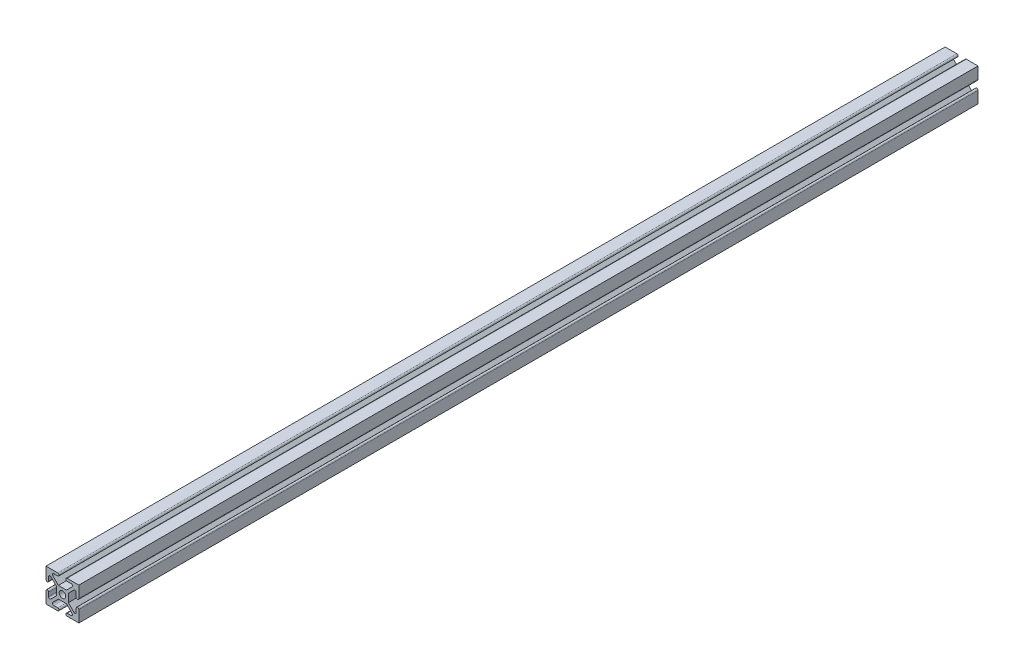
from build123d import *

# Parameters (mm, degrees)
SKETCH2_R               = 2.5
BOSS_EXTRUDE1_DEPTH     = 200
CROQUIS1_R              = 2.5
SALIENTE_EXTRUIR1_DEPTH = 484


with BuildPart() as part:
    # Sketch2 → Boss-Extrude1 (new body)
    with BuildSketch(Plane.XY):
        with BuildLine():
            Line((12.5, 17), (9.414213562, 17))
            Line((9.414213562, 17), (5.171572875, 21.242640687))
            ThreePointArc((5.171572875, 21.242640687), (4.94841893, 22.364511329), (5.899494937, 23))
            Line((5.899494937, 23), (8.899494937, 23))
            ThreePointArc((8.899494937, 23), (9.899494937, 24), (8.899494937, 25))
            Line((8.899494937, 25), (0, 25))
            Line((0, 25), (0, 16.100505063))
            ThreePointArc((0, 16.100505063), (1, 15.100505063), (2, 16.100505063))
            Line((2, 16.100505063), (2, 19.100505063))
            ThreePointArc((2, 19.100505063), (2.635488671, 20.05158107), (3.757359313, 19.828427125))
            Line((3.757359313, 19.828427125), (8, 15.585786438))
            Line((8, 15.585786438), (8, 12.5))
            Line((8, 12.5), (8, 9.414213562))
            Line((8, 9.414213562), (3.757359313, 5.171572875))
            ThreePointArc((3.757359313, 5.171572875), (2.635488671, 4.94841893), (2, 5.899494937))
            Line((2, 5.899494937), (2, 8.899494937))
            ThreePointArc((2, 8.899494937), (1, 9.899494937), (0, 8.899494937))
            Line((0, 8.899494937), (0, 0))
            Line((0, 0), (8.899494937, 0))
            ThreePointArc((8.899494937, 0), (9.899494937, 1), (8.899494937, 2))
            Line((8.899494937, 2), (5.899494937, 2))
            ThreePointArc((5.899494937, 2), (4.94841893, 2.635488671), (5.171572875, 3.757359313))
            Line((5.171572875, 3.757359313), (9.414213562, 8))
            Line((9.414213562, 8), (12.5, 8))
            Line((12.5, 8), (15.585786438, 8))
            Line((15.585786438, 8), (19.828427125, 3.757359313))
            ThreePointArc((19.828427125, 3.757359313), (20.05158107, 2.635488671), (19.100505063, 2))
            Line((19.100505063, 2), (16.100505063, 2))
            ThreePointArc((16.100505063, 2), (15.100505063, 1), (16.100505063, 0))
            Line((16.100505063, 0), (25, 0))
            Line((25, 0), (25, 8.899494937))
            ThreePointArc((25, 8.899494937), (24, 9.899494937), (23, 8.899494937))
            Line((23, 8.899494937), (23, 5.899494937))
            ThreePointArc((23, 5.899494937), (22.364511329, 4.94841893), (21.242640687, 5.171572875))
            Line((21.242640687, 5.171572875), (17, 9.414213562))
            Line((17, 9.414213562), (17, 12.5))
            Line((17, 12.5), (17, 15.585786438))
            Line((17, 15.585786438), (21.242640687, 19.828427125))
            ThreePointArc((21.242640687, 19.828427125), (22.364511329, 20.05158107), (23, 19.100505063))
            Line((23, 19.100505063), (23, 16.100505063))
            ThreePointArc((23, 16.100505063), (24, 15.100505063), (25, 16.100505063))
            Line((25, 16.100505063), (25, 25))
            Line((25, 25), (16.100505063, 25))
            ThreePointArc((16.100505063, 25), (15.100505063, 24), (16.100505063, 23))
            Line((16.100505063, 23), (19.100505063, 23))
            ThreePointArc((19.100505063, 23), (20.05158107, 22.364511329), (19.828427125, 21.242640687))
            Line((19.828427125, 21.242640687), (15.585786438, 17))
            Line((15.585786438, 17), (12.5, 17))
        make_face()
        with Locations((12.5, 12.5)):
            Circle(SKETCH2_R, mode=Mode.SUBTRACT)
    extrude(amount=BOSS_EXTRUDE1_DEPTH)

    # Croquis1 → Saliente-Extruir1 (add)
    with BuildSketch(Plane.XY.offset(200)):
        with BuildLine():
            ThreePointArc((2, 8.899494937), (1, 9.899494937), (0, 8.899494937))
            Line((0, 8.899494937), (0, 0))
            Line((0, 0), (8.899494937, 0))
            ThreePointArc((8.899494937, 0), (9.899494937, 1), (8.899494937, 2))
            Line((8.899494937, 2), (5.93353822, 2))
            ThreePointArc((5.93353822, 2), (4.947899018, 2.635273316), (5.195645112, 3.78143155))
            Line((5.195645112, 3.78143155), (9.414213562, 8))
            Line((9.414213562, 8), (15.585786438, 8))
            Line((15.585786438, 8), (19.828427125, 3.757359313))
            ThreePointArc((19.828427125, 3.757359313), (20.05158107, 2.635488671), (19.100505063, 2))
            Line((19.100505063, 2), (16.100505063, 2))
            ThreePointArc((16.100505063, 2), (15.100505063, 1), (16.100505063, 0))
            Line((16.100505063, 0), (25, 0))
            Line((25, 0), (25, 8.899494937))
            ThreePointArc((25, 8.899494937), (24, 9.899494937), (23, 8.899494937))
            Line((23, 8.899494937), (23, 5.899494937))
            ThreePointArc((23, 5.899494937), (22.364511329, 4.94841893), (21.242640687, 5.171572875))
            Line((21.242640687, 5.171572875), (17, 9.414213562))
            Line((17, 9.414213562), (17, 15.585786438))
            Line((17, 15.585786438), (21.242640687, 19.828427125))
            ThreePointArc((21.242640687, 19.828427125), (22.364511329, 20.05158107), (23, 19.100505063))
            Line((23, 19.100505063), (23, 16.100505063))
            ThreePointArc((23, 16.100505063), (24, 15.100505063), (25, 16.100505063))
            Line((25, 16.100505063), (25, 25))
            Line((25, 25), (16.100505063, 25))
            ThreePointArc((16.100505063, 25), (15.100505063, 24), (16.100505063, 23))
            Line((16.100505063, 23), (19.100505063, 23))
            ThreePointArc((19.100505063, 23), (20.05158107, 22.364511329), (19.828427125, 21.242640687))
            Line((19.828427125, 21.242640687), (15.585786438, 17))
            Line((15.585786438, 17), (9.414213562, 17))
            Line((9.414213562, 17), (5.171572875, 21.242640687))
            ThreePointArc((5.171572875, 21.242640687), (4.94841893, 22.364511329), (5.899494937, 23))
            Line((5.899494937, 23), (8.899494937, 23))
            ThreePointArc((8.899494937, 23), (9.899494937, 24), (8.899494937, 25))
            Line((8.899494937, 25), (0, 25))
            Line((0, 25), (0, 16.100505063))
            ThreePointArc((0, 16.100505063), (1, 15.100505063), (2, 16.100505063))
            Line((2, 16.100505063), (2, 19.100505063))
            ThreePointArc((2, 19.100505063), (2.635488671, 20.05158107), (3.757359313, 19.828427125))
            Line((3.757359313, 19.828427125), (8, 15.585786438))
            Line((8, 15.585786438), (8, 9.414213562))
            Line((8, 9.414213562), (3.757359313, 5.171572875))
            ThreePointArc((3.757359313, 5.171572875), (2.635488671, 4.94841893), (2, 5.899494937))
            Line((2, 5.899494937), (2, 8.899494937))
        make_face()
        with Locations((12.5, 12.5)):
            Circle(CROQUIS1_R, mode=Mode.SUBTRACT)
    extrude(amount=SALIENTE_EXTRUIR1_DEPTH)


solid = part.part
